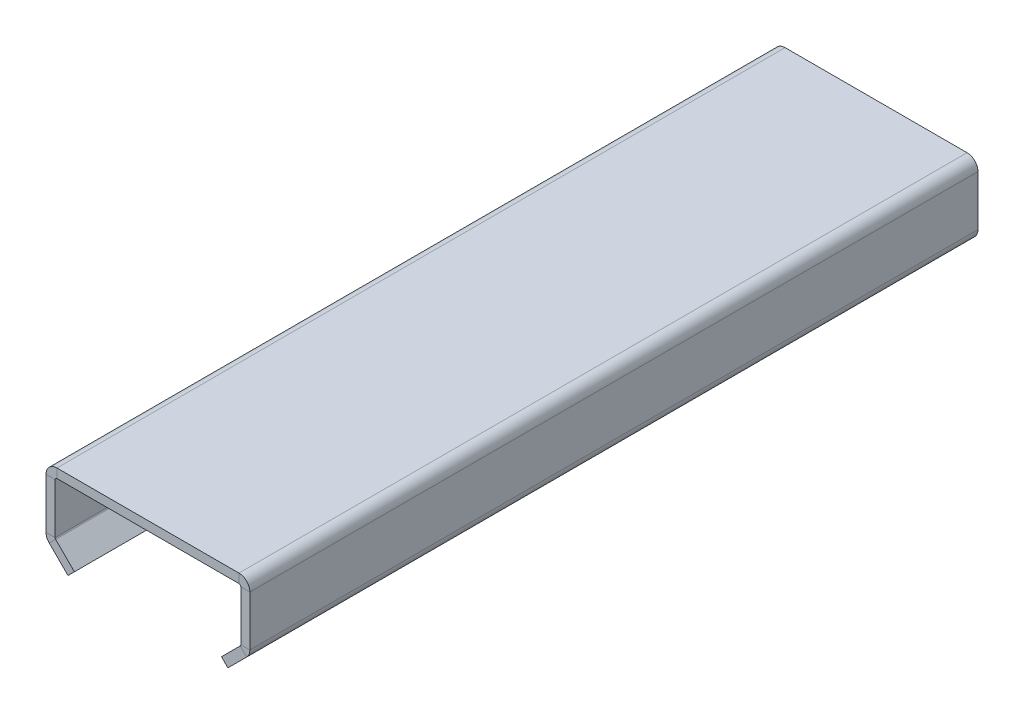
from build123d import *

# Parameters (mm, degrees)
BASE_FLANGE1_DEPTH = 200


# Sheet-metal steps are written as plain solids
with BuildPart() as part:
    # Sketch1 → Base-Flange1 (new, symmetric)
    with BuildSketch(Plane.XY):
        with BuildLine():
            Line((0, 0), (-10.313708499, 10.313708499))
            ThreePointArc((-10.313708499, 10.313708499), (-10.53048125, 10.638131848), (-10.606601718, 11.02081528))
            Line((-10.606601718, 11.02081528), (-10.606601718, 38.606601718))
            ThreePointArc((-10.606601718, 38.606601718), (-10.313708499, 39.313708499), (-9.606601718, 39.606601718))
            Line((-9.606601718, 39.606601718), (90.393398282, 39.606601718))
            ThreePointArc((90.393398282, 39.606601718), (91.100505063, 39.313708499), (91.393398282, 38.606601718))
            Line((91.393398282, 38.606601718), (91.393398282, 11.02081528))
            ThreePointArc((91.393398282, 11.02081528), (91.317277815, 10.638131848), (91.100505063, 10.313708499))
            Line((91.100505063, 10.313708499), (80.786796564, 0))
            Line((80.786796564, 0), (84.32233047, -3.535533906))
            Line((84.32233047, -3.535533906), (94.636038969, 6.778174593))
            ThreePointArc((94.636038969, 6.778174593), (95.936675477, 8.724714686), (96.393398282, 11.02081528))
            Line((96.393398282, 11.02081528), (96.393398282, 38.606601718))
            ThreePointArc((96.393398282, 38.606601718), (94.636038969, 42.849242405), (90.393398282, 44.606601718))
            Line((90.393398282, 44.606601718), (-9.606601718, 44.606601718))
            ThreePointArc((-9.606601718, 44.606601718), (-13.849242405, 42.849242405), (-15.606601718, 38.606601718))
            Line((-15.606601718, 38.606601718), (-15.606601718, 11.02081528))
            ThreePointArc((-15.606601718, 11.02081528), (-15.149878913, 8.724714686), (-13.849242405, 6.778174593))
            Line((-13.849242405, 6.778174593), (-3.535533906, -3.535533906))
            Line((-3.535533906, -3.535533906), (0, 0))
        make_face()
    extrude(amount=BASE_FLANGE1_DEPTH, both=True)


solid = part.part
